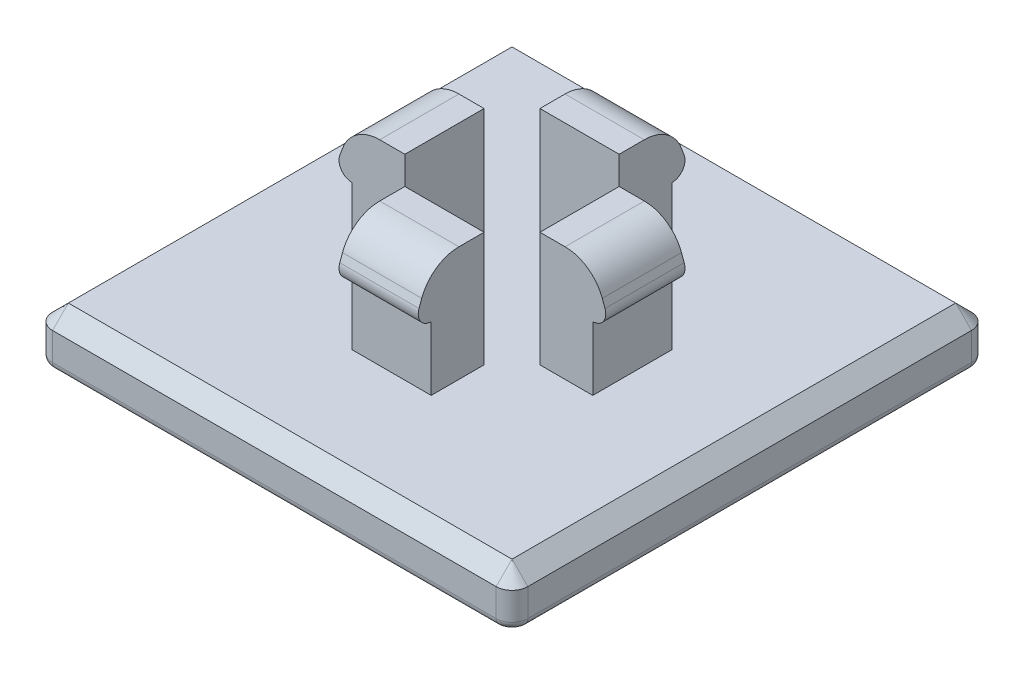
from build123d import *

# Parameters (mm, degrees)
BOSS_EXTRUDE1_DEPTH = 1.651
SKETCH3_W           = 2.54
SKETCH3_H           = 1.694812446
SKETCH3_W_2         = 1.694812446
SKETCH3_H_2         = 2.54
BOSS_EXTRUDE2_DEPTH = 3.683
BOSS_EXTRUDE3_DEPTH = 1.27
BOSS_EXTRUDE4_DEPTH = 1.27
FILLET1_R           = 1.27
CHAMFER1_SIZE       = 0.508
FILLET2_R           = 0.254


with BuildPart() as part:
    # Sketch1 → Boss-Extrude1 (new body)
    with BuildSketch(Plane(origin=(0, 0, 0), x_dir=(1, 0, 0), z_dir=(0, 1, 0))):
        with BuildLine():
            Line((-7.62, 7.112), (-7.62, -7.112))
            ThreePointArc((-7.62, -7.112), (-7.471210245, -7.471210245), (-7.112, -7.62))
            Line((-7.112, -7.62), (7.112, -7.62))
            ThreePointArc((7.112, -7.62), (7.471210245, -7.471210245), (7.62, -7.112))
            Line((7.62, -7.112), (7.62, 7.112))
            ThreePointArc((7.62, 7.112), (7.471210245, 7.471210245), (7.112, 7.62))
            Line((7.112, 7.62), (-7.112, 7.62))
            ThreePointArc((-7.112, 7.62), (-7.471210245, 7.471210245), (-7.62, 7.112))
        make_face()
    extrude(amount=BOSS_EXTRUDE1_DEPTH)

    # Sketch3 → Boss-Extrude2 (add)
    with BuildSketch(Plane(origin=(0, 1.651, 0), x_dir=(1, 0, 0), z_dir=(0, 1, 0))):
        with Locations((0, 3.013059552)):
            Rectangle(SKETCH3_W, SKETCH3_H)
        with Locations((3.013059552, 0)):
            Rectangle(SKETCH3_W_2, SKETCH3_H_2)
        with Locations((0, -3.013059552)):
            Rectangle(SKETCH3_W, SKETCH3_H)
        with Locations((-3.013059552, 0)):
            Rectangle(SKETCH3_W_2, SKETCH3_H_2)
    extrude(amount=BOSS_EXTRUDE2_DEPTH)

    # Sketch4 → Boss-Extrude3 (add, symmetric)
    with BuildSketch(Plane.XY):
        with BuildLine():
            Line((-3.860465775, 5.334), (-4.251394799, 4.259931334))
            ThreePointArc((-4.251394799, 4.259931334), (-4.201247752, 3.879026697), (-3.860465775, 3.701626828))
            Line((-3.860465775, 3.701626828), (-3.860465775, 5.334))
        make_face()
        with BuildLine():
            Line((3.860465775, 5.334), (4.251394799, 4.259931334))
            ThreePointArc((4.251394799, 4.259931334), (4.201247752, 3.879026697), (3.860465775, 3.701626828))
            Line((3.860465775, 3.701626828), (3.860465775, 5.334))
        make_face()
    extrude(amount=BOSS_EXTRUDE3_DEPTH, both=True)

    # Sketch5 → Boss-Extrude4 (add, symmetric)
    with BuildSketch(Plane(origin=(0, 0, 0), x_dir=(0, 0, -1), z_dir=(1, 0, 0))):
        with BuildLine():
            Line((-3.860465775, 5.334), (-4.251394799, 4.259931334))
            ThreePointArc((-4.251394799, 4.259931334), (-4.201512131, 3.878082751), (-3.860465775, 3.699242027))
            Line((-3.860465775, 3.699242027), (-3.860465775, 5.334))
        make_face()
        with BuildLine():
            Line((3.860465775, 5.334), (4.251394799, 4.259931334))
            ThreePointArc((4.251394799, 4.259931334), (4.201512131, 3.878082751), (3.860465775, 3.699242027))
            Line((3.860465775, 3.699242027), (3.860465775, 5.334))
        make_face()
    extrude(amount=BOSS_EXTRUDE4_DEPTH, both=True)

    # Fillet1
    fillet1_edges = [part.edges().sort_by_distance(p)[0] for p in [
        (0, 5.334, -3.860465775),
        (3.860465775, 5.334, 0),
        (0, 5.334, 3.860465775),
        (-3.860465775, 5.334, 0),
    ]]
    fillet(fillet1_edges, radius=FILLET1_R)

    # Chamfer1
    chamfer1_edges = [part.edges().sort_by_distance(p)[0] for p in [
        (7.471210245, 1.651, 7.471210245),
        (7.62, 1.651, 0),
        (7.471210245, 1.651, -7.471210245),
        (0, 1.651, -7.62),
        (-7.471210245, 1.651, -7.471210245),
        (-7.62, 1.651, 0),
        (-7.471210245, 1.651, 7.471210245),
        (0, 1.651, 7.62),
    ]]
    chamfer(chamfer1_edges, length=CHAMFER1_SIZE - 0.0001)  # a hair under: the kernel refuses the full size

    # Fillet2
    fillet2_edges = [part.edges().sort_by_distance(p)[0] for p in [
        (0, 0, 7.62),
        (-7.471210245, 0, 7.471210245),
        (-7.62, 0, 0),
        (-7.471210245, 0, -7.471210245),
        (0, 0, -7.62),
        (7.471210245, 0, -7.471210245),
        (7.62, 0, 0),
        (7.471210245, 0, 7.471210245),
    ]]
    fillet(fillet2_edges, radius=FILLET2_R)


solid = part.part
